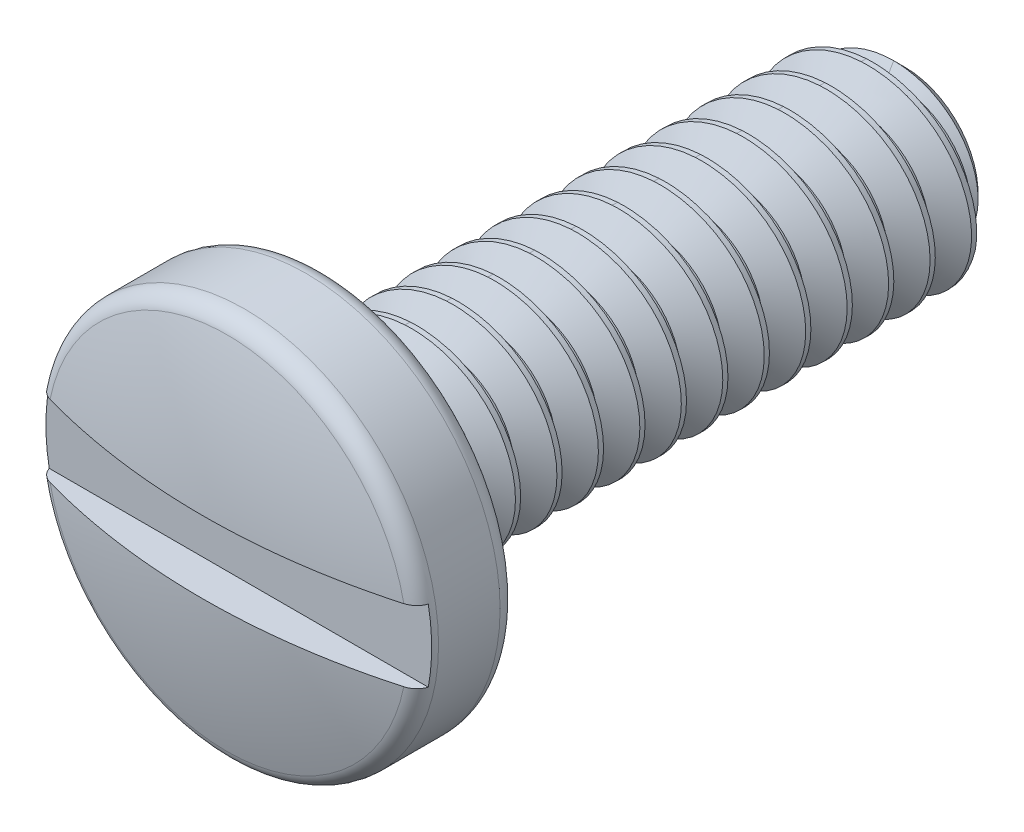
from build123d import *

# Parameters (mm, degrees)
SKETCH3_W               = 6.35
SKETCH3_H               = 0.797596715
SWEEP1_PITCH            = 0.453571429
SWEEP2_PITCH            = 0.453571429
SKETCH10_W              = 254
SKETCH10_H              = 12.7
SKETCH8_W               = 1.3462
SKETCH8_H               = 2.1209
SKETCH12_W              = 4.2418
SKETCH12_H              = 0.7874
CUT_EXTRUDE_THIN2_DEPTH = 0.4064


with BuildPart() as part:
    # Sketch3 → Revolve1 (revolve)
    with BuildSketch(Plane(origin=(0, 0, 0), x_dir=(0, 0, -1), z_dir=(1, 0, 0)), mode=Mode.PRIVATE) as revolve1_sk:
        with Locations((-3.175, 0.398798358)):
            Rectangle(SKETCH3_W, SKETCH3_H)
    revolve(revolve1_sk.sketch.rotate(Axis((0, 0, 0), (0, 0, -1)), 90), axis=Axis((0, 0, 0), (0, 0, -1)))

    # Sweep1: the profile of Sketch2 profile screwed along a right-hand helix of 15 turns, 6 arcs to a turn; built about Z, then put on its axis
    sweep1_z = Axis((0, 0, 0), (0, 0, 1))
    sweep1_corners = [(1.0922, 0, 0.028348214), (1.0922, 0, -0.028348214), (0.797296715, 0, -0.198610705), (0.797296715, 0, 0.198610705)]
    with BuildLine(mode=Mode.PRIVATE) as sweep1_profile:
        Line(sweep1_corners[0], sweep1_corners[1])
        Line(sweep1_corners[1], sweep1_corners[2])
        Line(sweep1_corners[2], sweep1_corners[3])
        Line(sweep1_corners[3], sweep1_corners[0])
    sweep1_cap = Face(sweep1_profile.wire())
    sweep1_turn_angles = [0, 30, 60, 90, 120, 150, 180, 210, 240, 270, 300, 330, 360]
    sweep1_turn_weights = [1, 0.8660254037844387, 1, 0.8660254037844387, 1, 0.8660254037844387, 1, 0.8660254037844387, 1, 0.8660254037844387, 1, 0.8660254037844387, 1]
    sweep1_turn_rails = [Edge.make_bspline([Vector(p[0], p[1], 0).rotate(sweep1_z, sweep1_turn_angles[k]) / sweep1_turn_weights[k] + Vector(0, 0, p[2] + SWEEP1_PITCH * sweep1_turn_angles[k] / 360) for k in range(13)], [0, 0, 0, 1, 1, 2, 2, 3, 3, 4, 4, 5, 5, 6, 6, 6], 2, sweep1_turn_weights) for p in sweep1_corners]
    sweep1_turn_sides = [Face.make_surface_from_curves(sweep1_turn_rails[p[0]], sweep1_turn_rails[p[1]]) for p in [(0, 1), (1, 2), (2, 3), (3, 0)]]
    sweep1 = Plane(origin=(0, 0, 0), x_dir=(0, 1, 0), z_dir=(0, 0, 1)) * Solid(Shell([*[p.moved(Location((0, 0, SWEEP1_PITCH * i))) for i in range(15) for p in sweep1_turn_sides], sweep1_cap, sweep1_cap.rotate(sweep1_z, 5400).moved(Location((0, 0, SWEEP1_PITCH * 5400 / 360)))]))
    add(sweep1)

    # Sweep2: the profile of Sketch6 screwed along a right-hand helix of 1 turns, 6 arcs to a turn; built about Z, then put on its axis
    sweep2_z = Axis((0, 0, 0), (0, 0, 1))
    sweep2_corners = [(1.0922, 0, -0.028348214), (0.797596715, 0, -0.1984375), (0.797596715, 0, 0), (0.797596715, 0, 0.1984375), (1.0922, 0, 0.028348214)]
    with BuildLine(mode=Mode.PRIVATE) as sweep2_profile:
        Line(sweep2_corners[0], sweep2_corners[1])
        Line(sweep2_corners[1], sweep2_corners[2])
        Line(sweep2_corners[2], sweep2_corners[3])
        Line(sweep2_corners[3], sweep2_corners[4])
        Line(sweep2_corners[4], sweep2_corners[0])
    sweep2_cap = Face(sweep2_profile.wire())
    sweep2_turn_angles = [0, 30, 60, 90, 120, 150, 180, 210, 240, 270, 300, 330, 360]
    sweep2_turn_weights = [1, 0.8660254037844387, 1, 0.8660254037844387, 1, 0.8660254037844387, 1, 0.8660254037844387, 1, 0.8660254037844387, 1, 0.8660254037844387, 1]
    sweep2_turn_rails = [Edge.make_bspline([Vector(p[0], p[1], 0).rotate(sweep2_z, sweep2_turn_angles[k]) / sweep2_turn_weights[k] + Vector(0, 0, p[2] + SWEEP2_PITCH * sweep2_turn_angles[k] / 360) for k in range(13)], [0, 0, 0, 1, 1, 2, 2, 3, 3, 4, 4, 5, 5, 6, 6, 6], 2, sweep2_turn_weights) for p in sweep2_corners]
    sweep2_turn_sides = [Face.make_surface_from_curves(sweep2_turn_rails[p[0]], sweep2_turn_rails[p[1]]) for p in [(0, 1), (1, 2), (2, 3), (3, 4), (4, 0)]]
    sweep2 = Plane(origin=(0, 0, 0), x_dir=(0, 1, 0), z_dir=(0, 0, -1)) * Solid(Shell([*sweep2_turn_sides, sweep2_cap, sweep2_cap.rotate(sweep2_z, 360).moved(Location((0, 0, SWEEP2_PITCH * 360 / 360)))]))
    add(sweep2)

    # Sketch4 → Cut-Revolve1 (revolve, cut)
    with BuildSketch(Plane(origin=(0, 0, 0), x_dir=(0, 0, -1), z_dir=(1, 0, 0))):
        Polygon((0, 0.797596715), (-3.175, 3.972596715), (2.54, 3.972596715), (2.54, 0), (0, 0), align=None)
    revolve(axis=Axis((0, 0, -2.54), (0, 0, -1)), mode=Mode.SUBTRACT)

    # Sketch10 → Cut-Revolve2 (revolve, cut)
    with BuildSketch(Plane(origin=(0, 0, 0), x_dir=(0, 0, -1), z_dir=(1, 0, 0))):
        with Locations((-133.35, 6.35)):
            Rectangle(SKETCH10_W, SKETCH10_H)
    revolve(axis=Axis((0, 0, 0), (0, 0, -1)), mode=Mode.SUBTRACT)

    # Sketch8 → Revolve2 (revolve)
    with BuildSketch(Plane(origin=(0, 0, 0), x_dir=(0, 0, -1), z_dir=(1, 0, 0)), mode=Mode.PRIVATE) as revolve2_sk:
        with Locations((-7.0231, 1.06045)):
            Rectangle(SKETCH8_W, SKETCH8_H)
    revolve(revolve2_sk.sketch.rotate(Axis((0, 0, 0), (0, 0, 1)), 90), axis=Axis((0, 0, 0), (0, 0, 1)))

    # Sketch11 → Cut-Revolve3 (revolve, cut)
    with BuildSketch(Plane(origin=(0, 0, 0), x_dir=(0, 0, -1), z_dir=(1, 0, 0)), mode=Mode.PRIVATE) as cut_revolve3_sk:
        with BuildLine():
            Line((-7.22503, 2.1209), (-6.55193, 2.1209))
            ThreePointArc((-6.55193, 2.1209), (-6.409143928, 2.061756072), (-6.35, 1.91897))
            Line((-6.35, 1.91897), (-5.715, 1.91897))
            Line((-5.715, 1.91897), (-5.715, 2.7559))
            Line((-5.715, 2.7559), (-8.3312, 2.7559))
            Line((-8.3312, 2.7559), (-8.3312, 0))
            Line((-8.3312, 0), (-7.6962, 0))
            ThreePointArc((-7.6962, 0), (-7.626603307, 0.996939733), (-7.41916336, 1.974539446))
            ThreePointArc((-7.41916336, 1.974539446), (-7.346591891, 2.080210291), (-7.22503, 2.1209))
        make_face()
    revolve(cut_revolve3_sk.sketch.rotate(Axis((0, 0, 7.6962), (0, 0, -1)), 180), axis=Axis((0, 0, 7.6962), (0, 0, -1)), mode=Mode.SUBTRACT)

    # Sketch12 → Cut-Extrude-Thin2 (cut)
    with BuildSketch(Plane.XY.offset(7.6962)):
        Rectangle(SKETCH12_W, SKETCH12_H)
    extrude(amount=-CUT_EXTRUDE_THIN2_DEPTH, mode=Mode.SUBTRACT)


solid = part.part
